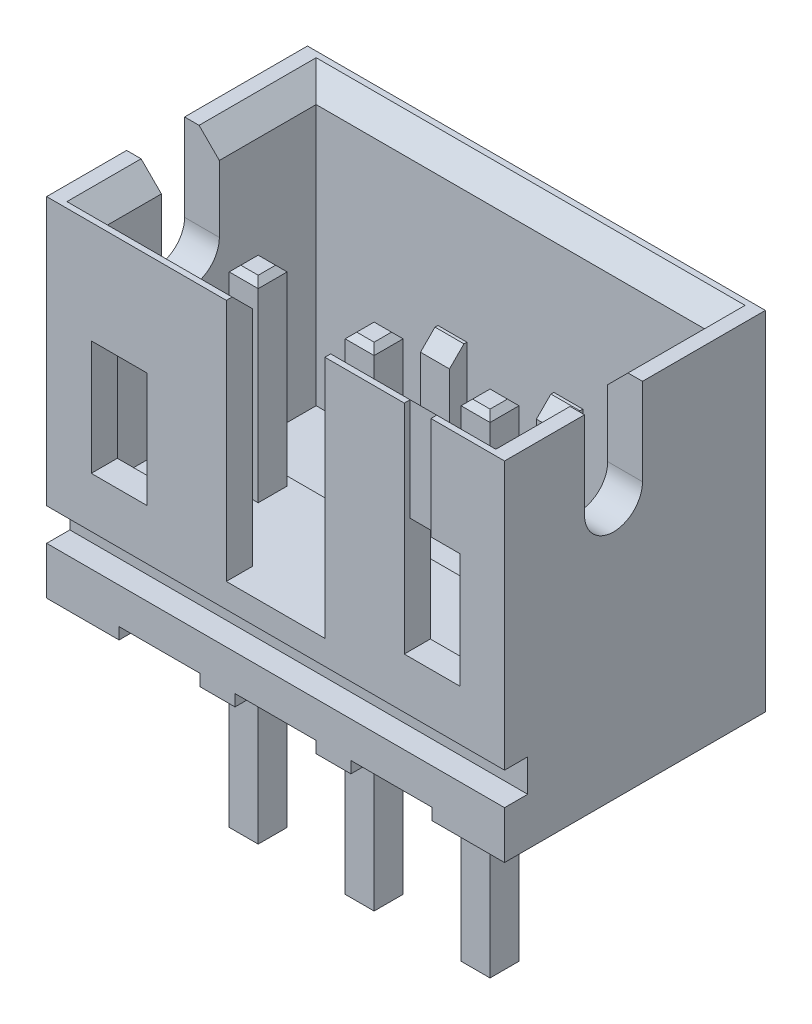
from build123d import *

# Parameters (mm, degrees)
BODY1_W                            = 7.9
BODY1_H                            = 4.5
EXTRUDE_1_DEPTH                    = 6
SKETCH_2_W                         = 6.7
SKETCH_2_H                         = 3.6
CUT_EXTRUDE_1_DEPTH                = 4.2
SKETCH_3_W                         = 7.9
SKETCH_3_H                         = 0.56
CUT_EXTRUDE_2_DEPTH                = 0.4
CHAMFER_1_SIZE                     = 0.35
CUT_EXTRUDE_3_REACH                = 12.893
SKETCH_4_W                         = 0.96
SKETCH_4_H                         = 1.98
SKETCH_5_W                         = 1.4
SKETCH_5_H                         = 0.2
CUT_EXTRUDE_4_DEPTH                = 11.893117093
SKETCH_7_W                         = 0.46
SKETCH_7_H                         = 1.77
CUT_EXTRUDE_5_DEPTH                = 0.1
CUT_EXTRUDE_6_REACH                = 12.893
SKETCH_8_W                         = 1.7
SKETCH_8_H                         = 4.2
CUT_EXTRUDE_7_REACH                = 12.893
SKETCH_15_W                        = 6.7
SKETCH_15_H                        = 1.95
CUT_EXTRUDE_9_DEPTH                = 0.65
CHAMFER_7_SIZE                     = 0.65
SKETCH_10_W                        = 0.5
SKETCH_10_H                        = 2.25
EXTRUDE_2_DEPTH                    = 0.3
CHAMFER_2_SIZE                     = 0.25
PATTERN_LINEAR_3_COUNT             = 2
PATTERN_LINEAR_3_PITCH             = 2
CHAMFER_2_OF_PATTERN_LINEAR_3_SIZE = 0.25
EXTRUDE_START                      = -4.9
SKETCH_12_W                        = 0.5
SKETCH_12_H                        = 0.5
EXTRUDE_4_DEPTH                    = 8.5
CHAMFER_3_SIZE                     = 0.1
CHAMFER_4_SIZE                     = 0.1
PATTERN_LINEAR_2_COUNT             = 3
PATTERN_LINEAR_2_PITCH             = 2
CHAMFER_3_OF_PATTERN_LINEAR_2_SIZE = 0.1
CHAMFER_4_OF_PATTERN_LINEAR_2_SIZE = 0.1
SKETCH_16_R                        = 0.05
CUT_EXTRUDE_10_DEPTH               = 3.4


with BuildPart() as part:
    # Body1 → Бобышка-Вытянуть1 (new body)
    with BuildSketch(Plane(origin=(0, 0, 0), x_dir=(1, 0, 0), z_dir=(0, 1, 0))):
        with Locations((3.95, -2.25)):
            Rectangle(BODY1_W, BODY1_H)
    extrude(amount=EXTRUDE_1_DEPTH)

    # Эскиз2 → Вырез-Вытянуть1 (cut)
    with BuildSketch(Plane(origin=(0, 6, 0), x_dir=(1, 0, 0), z_dir=(0, 1, 0))):
        with Locations((3.95, -2.25)):
            Rectangle(SKETCH_2_W, SKETCH_2_H)
    extrude(amount=-CUT_EXTRUDE_1_DEPTH, mode=Mode.SUBTRACT)

    # Эскиз3 → Вырез-Вытянуть2 (cut)
    with BuildSketch(Plane.XY.offset(4.5)):
        with Locations((3.95, 1.1)):
            Rectangle(SKETCH_3_W, SKETCH_3_H)
    extrude(amount=-CUT_EXTRUDE_2_DEPTH, mode=Mode.SUBTRACT)

    # Фаска1
    chamfer_1_edges = [part.edges().sort_by_distance(p)[0] for p in [
        (3.95, 6, 4.05),
        (7.3, 6, 2.25),
        (3.95, 6, 0.45),
        (0.6, 6, 2.25),
    ]]
    chamfer(chamfer_1_edges, length=CHAMFER_1_SIZE)

    # Эскиз4 → Вырез-Вытянуть3 (cut, up to next)
    with BuildSketch(Plane.XY.offset(4.5), mode=Mode.PRIVATE) as cut_extrude_3_sk1:
        with Locations((1.25, 3.24)):
            Rectangle(SKETCH_4_W, SKETCH_4_H)
    cut_extrude_3_tool1 = extrude(cut_extrude_3_sk1.sketch, amount=-CUT_EXTRUDE_3_REACH, mode=Mode.PRIVATE) & part.part
    # Эскиз4 → Вырез-Вытянуть3 (cut, up to next)
    with BuildSketch(Plane.XY.offset(4.5), mode=Mode.PRIVATE) as cut_extrude_3_sk2:
        with Locations((6.65, 3.24)):
            Rectangle(SKETCH_4_W, SKETCH_4_H)
    cut_extrude_3_tool2 = extrude(cut_extrude_3_sk2.sketch, amount=-CUT_EXTRUDE_3_REACH, mode=Mode.PRIVATE) & part.part
    add(cut_extrude_3_tool1.solids().sort_by_distance((1.25, 3.24, 4.5))[0], mode=Mode.SUBTRACT)
    add(cut_extrude_3_tool2.solids().sort_by_distance((6.65, 3.24, 4.5))[0], mode=Mode.SUBTRACT)

    # Эскиз5 → Вырез-Вытянуть4 (cut, through all)
    with BuildSketch(Plane.XY.offset(4.5)):
        with Locations((1.95, 0.1)):
            Rectangle(SKETCH_5_W, SKETCH_5_H)
    cut_extrude_4 = extrude(amount=-CUT_EXTRUDE_4_DEPTH, mode=Mode.SUBTRACT)

    # Эскиз7 → Вырез-Вытянуть5 (cut)
    with BuildSketch(Plane.XY.offset(4.5)):
        with Locations((6.4, 5.115)):
            Rectangle(SKETCH_7_W, SKETCH_7_H)
    extrude(amount=-CUT_EXTRUDE_5_DEPTH, mode=Mode.SUBTRACT)

    # Эскиз8 → Вырез-Вытянуть6 (cut, up to next)
    with BuildSketch(Plane.XY.offset(4.5), mode=Mode.PRIVATE) as cut_extrude_6_sk1:
        with Locations((3.95, 3.9)):
            Rectangle(SKETCH_8_W, SKETCH_8_H)
    cut_extrude_6_tool1 = extrude(cut_extrude_6_sk1.sketch, amount=-CUT_EXTRUDE_6_REACH, mode=Mode.PRIVATE) & part.part
    add(cut_extrude_6_tool1.solids().sort_by_distance((3.95, 3.9, 4.5))[0], mode=Mode.SUBTRACT)

    # Эскиз9 → Вырез-Вытянуть7 (cut, up to next)
    with BuildSketch(Plane.ZY, mode=Mode.PRIVATE) as cut_extrude_7_sk1:
        with BuildLine():
            Line((2.12, 6), (3.12, 6))
            Line((3.12, 6), (3.12, 4.5))
            ThreePointArc((3.12, 4.5), (2.62, 4), (2.12, 4.5))
            Line((2.12, 4.5), (2.12, 6))
        make_face()
    cut_extrude_7_tool1 = extrude(cut_extrude_7_sk1.sketch, amount=-CUT_EXTRUDE_7_REACH, mode=Mode.PRIVATE) & part.part
    cut_extrude_7 = cut_extrude_7_tool1.solids().sort_by_distance((0, 5.05036, 2.62))[0]
    add(cut_extrude_7, mode=Mode.SUBTRACT)

    # Зеркальное отражение1: Вырез-Вытянуть7 across plane
    add(cut_extrude_7.mirror(Plane(origin=(3.95, 0, 0), x_dir=(0, 0, 1), z_dir=(1, 0, 0))), mode=Mode.SUBTRACT)

    # Эскиз15 → Вырез-Вытянуть9 (cut)
    with BuildSketch(Plane(origin=(0, 1.8, 0), x_dir=(1, 0, 0), z_dir=(0, 1, 0))):
        with Locations((3.95, -1.425)):
            Rectangle(SKETCH_15_W, SKETCH_15_H)
    extrude(amount=-CUT_EXTRUDE_9_DEPTH, mode=Mode.SUBTRACT)

    # Фаска7
    chamfer_7_edges = [part.edges().sort_by_distance(p)[0] for p in [
        (3.95, 1.15, 2.4),
    ]]
    chamfer(chamfer_7_edges, length=CHAMFER_7_SIZE - 0.0001)  # a hair under: the kernel refuses the full size

    # Эскиз10 → Бобышка-Вытянуть2 (add)
    with BuildSketch(Plane.XY.offset(0.45)):
        with Locations((2.95, 2.275)):
            Rectangle(SKETCH_10_W, SKETCH_10_H)
    extrude_2 = extrude(amount=EXTRUDE_2_DEPTH)

    # Фаска2
    chamfer_2_edges = [part.edges().sort_by_distance(p)[0] for p in [
        (2.95, 3.4, 0.75),
    ]]
    chamfer(chamfer_2_edges, length=CHAMFER_2_SIZE)

    # Линейный массив3: Бобышка-Вытянуть2 ×2
    with Locations(*[(i * PATTERN_LINEAR_3_PITCH, 0, 0) for i in range(1, PATTERN_LINEAR_3_COUNT)]):
        add(extrude_2)

    # Фаска2 of Линейный массив3
    chamfer_2_of_pattern_linear_3_edges = [part.edges().sort_by_distance(p)[0] for p in [
        (4.95, 3.4, 0.75),
    ]]
    chamfer(chamfer_2_of_pattern_linear_3_edges, length=CHAMFER_2_OF_PATTERN_LINEAR_3_SIZE)

    # Эскиз12 → Бобышка-Вытянуть4 (add)
    with BuildSketch(Plane.XZ.offset(-0.2).offset(EXTRUDE_START)):
        with Locations((1.95, 2.8)):
            Rectangle(SKETCH_12_W, SKETCH_12_H)
    extrude_4 = extrude(amount=EXTRUDE_4_DEPTH)

    # Фаска3
    chamfer_3_edges = [part.edges().sort_by_distance(p)[0] for p in [
        (1.7, -3.4, 2.8),
        (1.95, -3.4, 2.55),
        (2.2, -3.4, 2.8),
        (1.95, -3.4, 3.05),
    ]]
    chamfer(chamfer_3_edges, length=CHAMFER_3_SIZE)

    # Фаска4
    chamfer_4_edges = [part.edges().sort_by_distance(p)[0] for p in [
        (1.7, 5.1, 2.8),
        (1.95, 5.1, 2.55),
        (2.2, 5.1, 2.8),
        (1.95, 5.1, 3.05),
    ]]
    chamfer(chamfer_4_edges, length=CHAMFER_4_SIZE)

    # Линейный массив2: Вырез-Вытянуть4, Бобышка-Вытянуть4 ×3
    with Locations(*[(i * PATTERN_LINEAR_2_PITCH, 0, 0) for i in range(1, PATTERN_LINEAR_2_COUNT)]):
        add(cut_extrude_4, mode=Mode.SUBTRACT)
        add(extrude_4)

    # Фаска3 of Линейный массив2
    chamfer_3_of_pattern_linear_2_edges = [part.edges().sort_by_distance(p)[0] for p in [
        (3.7, -3.4, 2.8),
        (3.95, -3.4, 2.55),
        (4.2, -3.4, 2.8),
        (3.95, -3.4, 3.05),
        (5.7, -3.4, 2.8),
        (5.95, -3.4, 2.55),
        (6.2, -3.4, 2.8),
        (5.95, -3.4, 3.05),
    ]]
    chamfer(chamfer_3_of_pattern_linear_2_edges, length=CHAMFER_3_OF_PATTERN_LINEAR_2_SIZE)

    # Фаска4 of Линейный массив2
    chamfer_4_of_pattern_linear_2_edges = [part.edges().sort_by_distance(p)[0] for p in [
        (3.7, 5.1, 2.8),
        (3.95, 5.1, 2.55),
        (4.2, 5.1, 2.8),
        (3.95, 5.1, 3.05),
        (5.7, 5.1, 2.8),
        (5.95, 5.1, 2.55),
        (6.2, 5.1, 2.8),
        (5.95, 5.1, 3.05),
    ]]
    chamfer(chamfer_4_of_pattern_linear_2_edges, length=CHAMFER_4_OF_PATTERN_LINEAR_2_SIZE)

    # Эскиз16 → Вырез-Вытянуть10 (cut)
    with BuildSketch(Plane.XZ):
        with Locations((1.95, 2.8)):
            Circle(SKETCH_16_R)
    extrude(amount=CUT_EXTRUDE_10_DEPTH, mode=Mode.SUBTRACT)


solid = part.part
